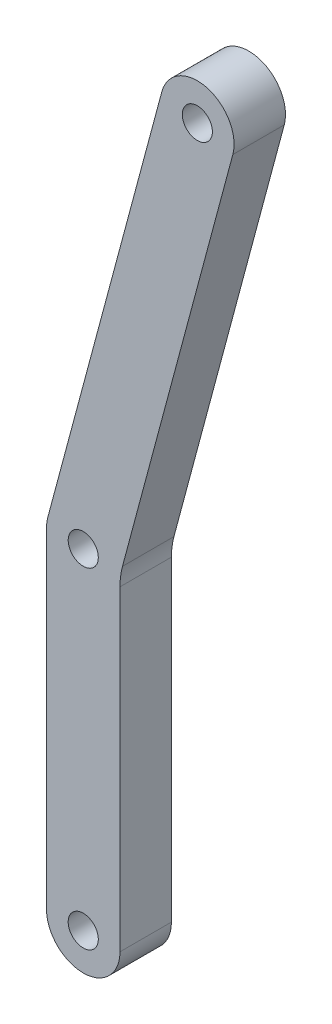
from build123d import *

# Parameters (mm, degrees)
ESQUISSE1_R        = 2.05
BOSS_EXTRU_1_DEPTH = 7
CONG_1_R           = 10


with BuildPart() as part:
    # Esquisse1 → Boss.-Extru.1 (new body)
    with BuildSketch(Plane.XY):
        with BuildLine():
            Line((-5, 45), (-5, 0))
            ThreePointArc((-5, 0), (0, -5), (5, 0))
            Line((5, 0), (5, 44.341737512))
            Line((5, 44.341737512), (20.358771838, 101.661454352))
            ThreePointArc((20.358771838, 101.661454352), (16.823237932, 107.785178709), (10.699513575, 104.249644803))
            Line((10.699513575, 104.249644803), (-4.829629131, 46.294095226))
            ThreePointArc((-4.829629131, 46.294095226), (-4.957224307, 45.652630961), (-5, 45))
        make_face()
        Circle(ESQUISSE1_R, mode=Mode.SUBTRACT)
        with Locations((0, 45)):
            Circle(ESQUISSE1_R, mode=Mode.SUBTRACT)
        with Locations((15.529142706, 102.955549577)):
            Circle(ESQUISSE1_R, mode=Mode.SUBTRACT)
    extrude(amount=BOSS_EXTRU_1_DEPTH)

    # Congé1
    cong_1_edges = [part.edges().sort_by_distance(p)[0] for p in [
        (5, 44.341737512, 3.5),
    ]]
    fillet(cong_1_edges, radius=CONG_1_R)


solid = part.part
